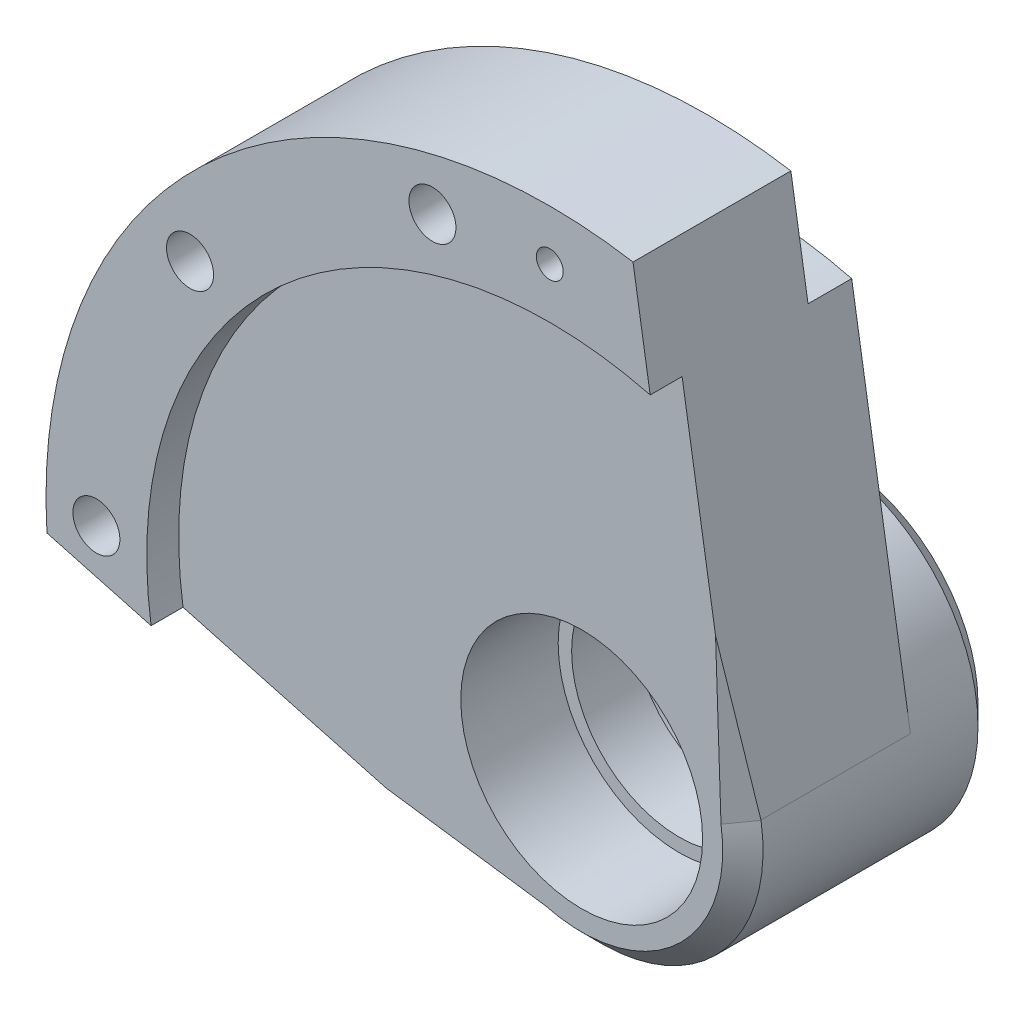
from build123d import *
from OCP.BRepAlgoAPI import BRepAlgoAPI_Cut
from OCP.TopTools import TopTools_ListOfShape
from build123d.topology import SkipClean

# Parameters (mm, degrees)
SCHIZZO1_R                          = 150
SCHIZZO1_R_2                        = 32
ESTRUSIONE1_DEPTH                   = 80.5
SCHIZZO2_R                          = 120
ESTRUSIONE2_DEPTH                   = 4.5
SCHIZZO3_R                          = 36
ESTRUSIONE3_DEPTH                   = 29
ESTRUSIONE4_START                   = -29
SCHIZZO4_R                          = 36
ESTRUSIONE4_DEPTH                   = 29
SCHIZZO5_OUTSIDE_W                  = 388.366
SCHIZZO5_OUTSIDE_H                  = 388.366
SCHIZZO5_OUTSIDE_R                  = 120
ESTRUSIONE5_DEPTH                   = 38.5
SCHIZZO6_OUTSIDE_W                  = 388.366
SCHIZZO6_OUTSIDE_H                  = 388.366
SCHIZZO6_OUTSIDE_R                  = 48
ESTRUSIONE6_DEPTH                   = 25.5
SCHIZZO7_R                          = 4
ESTRUSIONE7_DEPTH                   = 220.146070008
SCHIZZO8_R                          = 7
ESTRUSIONE8_DEPTH                   = 217.249855491
RIPETIZIONECIRCOLARE1_COUNT         = 3
RIPETIZIONECIRCOLARE1_ANGLE         = 75
SCHIZZO9_OUTSIDE_W                  = 388.366
SCHIZZO9_OUTSIDE_H                  = 388.366
ESTRUSIONE9_DEPTH                   = 220.146070008
SMUSSO1_SIZE                        = 6
TAGLIA_RIVOLUZIONE1_ANGLE           = 15
TAGLIA_RIVOLUZIONE1_OTHER_WAY_ANGLE = 99
ESTRUSIONE10_DEPTH                  = 222.553987295
ESTRUSIONE11_DEPTH                  = 222.120460483
SCHIZZO14_R                         = 7
SCHIZZO14_R_2                       = 4
ESTRUSIONE12_DEPTH                  = 5


with BuildPart() as part:
    # Schizzo1 → Estrusione1 (new body)
    with BuildSketch(Plane.XY):
        Circle(SCHIZZO1_R)
        Circle(SCHIZZO1_R_2, mode=Mode.SUBTRACT)
    extrude(amount=ESTRUSIONE1_DEPTH)

    # Schizzo2 → Estrusione2 (cut)
    with BuildSketch(Plane.XY.offset(80.5)):
        Circle(SCHIZZO2_R)
    extrude(amount=-ESTRUSIONE2_DEPTH, mode=Mode.SUBTRACT)

    # Schizzo3 → Estrusione3 (cut)
    with BuildSketch(Plane.XY.offset(76)):
        Circle(SCHIZZO3_R)
    extrude(amount=-ESTRUSIONE3_DEPTH, mode=Mode.SUBTRACT)

    # Schizzo4 → Estrusione4 (cut)
    with BuildSketch(Plane(origin=(0, 0, 0), x_dir=(-1, 0, 0), z_dir=(0, 0, -1)).offset(ESTRUSIONE4_START)):
        Circle(SCHIZZO4_R)
    extrude(amount=ESTRUSIONE4_DEPTH, mode=Mode.SUBTRACT)

    # Schizzo5 outside → Estrusione5 (cut)
    with BuildSketch(Plane(origin=(0, 0, 0), x_dir=(-1, 0, 0), z_dir=(0, 0, -1))):
        Rectangle(SCHIZZO5_OUTSIDE_W, SCHIZZO5_OUTSIDE_H)
        Circle(SCHIZZO5_OUTSIDE_R, mode=Mode.SUBTRACT)
    extrude(amount=-ESTRUSIONE5_DEPTH, mode=Mode.SUBTRACT)

    # Schizzo6 outside → Estrusione6 (cut)
    with BuildSketch(Plane(origin=(0, 0, 0), x_dir=(-1, 0, 0), z_dir=(0, 0, -1))):
        Rectangle(SCHIZZO6_OUTSIDE_W, SCHIZZO6_OUTSIDE_H)
        Circle(SCHIZZO6_OUTSIDE_R, mode=Mode.SUBTRACT)
    extrude(amount=-ESTRUSIONE6_DEPTH, mode=Mode.SUBTRACT)

    # Schizzo7 → Estrusione7 (cut, through all)
    with BuildSketch(Plane(origin=(0, 0, 25.5), x_dir=(-1, 0, 0), z_dir=(0, 0, -1))):
        with Locations((0, 135)):
            Circle(SCHIZZO7_R)
    extrude(amount=-ESTRUSIONE7_DEPTH, mode=Mode.SUBTRACT)

    # Schizzo8 → Estrusione8 (cut, through all)
    with BuildSketch(Plane(origin=(0, 0, 38.5), x_dir=(-1, 0, 0), z_dir=(0, 0, -1))):
        with Locations((135, 0)):
            Circle(SCHIZZO8_R)
    estrusione8 = extrude(amount=-ESTRUSIONE8_DEPTH, mode=Mode.SUBTRACT)

    # RipetizioneCircolare1: Estrusione8 ×3 about axis
    ripetizionecircolare1_axis = Axis((0, 0, 38.5), (0, 0, -1))
    for i in range(1, RIPETIZIONECIRCOLARE1_COUNT):
        add(estrusione8.rotate(ripetizionecircolare1_axis, i * RIPETIZIONECIRCOLARE1_ANGLE / (RIPETIZIONECIRCOLARE1_COUNT - 1)), mode=Mode.SUBTRACT)

    # Schizzo9 outside → Estrusione9 (cut, through all)
    with BuildSketch(Plane(origin=(0, 0, 25.5), x_dir=(-1, 0, 0), z_dir=(0, 0, -1))):
        Rectangle(SCHIZZO9_OUTSIDE_W, SCHIZZO9_OUTSIDE_H)
        with BuildLine():
            Line((-24.782961399, 147.938517041), (-47.388837837, 7.635368288))
            ThreePointArc((-47.388837837, 7.635368288), (-32.118274684, -35.670957819), (12.547023337, -46.331123511))
            Line((12.547023337, -46.331123511), (149.718619236, -9.183411899))
            ThreePointArc((149.718619236, -9.183411899), (100.369590954, 111.471723822), (-24.782961399, 147.938517041))
        make_face(mode=Mode.SUBTRACT)
    extrude(amount=-ESTRUSIONE9_DEPTH, mode=Mode.SUBTRACT)

    # Smusso1
    smusso1_edges = [part.edges().sort_by_distance(p)[0] for p in [
        (48, 0, 0),
    ]]
    chamfer(smusso1_edges, length=SMUSSO1_SIZE)


with BuildPart() as taglia_rivoluzione1_tool:
    # Schizzo10 → Taglia-Rivoluzione1 (revolve)
    with BuildSketch(Plane(origin=(0, 0, 0), x_dir=(0, 0, -1), z_dir=(1, 0, 0))):
        Polygon((-76, -42), (-70, -48), (-76, -48), align=None)
    revolve(axis=Axis((0, 0, 80.5), (0, 0, -1)), revolution_arc=TAGLIA_RIVOLUZIONE1_ANGLE)


with BuildPart() as part_1:
    add(part.part)

    # Taglia-Rivoluzione1: cut by taglia_rivoluzione1_tool, with a tolerance
    taglia_rivoluzione1_stock = TopTools_ListOfShape()
    taglia_rivoluzione1_stock.Append(part_1.part.wrapped)
    taglia_rivoluzione1_tools = TopTools_ListOfShape()
    taglia_rivoluzione1_tools.Append(taglia_rivoluzione1_tool.part.wrapped)
    taglia_rivoluzione1_cut = BRepAlgoAPI_Cut()
    taglia_rivoluzione1_cut.SetArguments(taglia_rivoluzione1_stock)
    taglia_rivoluzione1_cut.SetTools(taglia_rivoluzione1_tools)
    taglia_rivoluzione1_cut.SetFuzzyValue(0.00001)
    taglia_rivoluzione1_cut.Build()
    add(Compound.cast(taglia_rivoluzione1_cut.Shape()).solids(), mode=Mode.REPLACE)


with BuildPart() as taglia_rivoluzione1_other_way_tool:
    # Schizzo10 → Taglia-Rivoluzione1 other way (revolve)
    with BuildSketch(Plane(origin=(0, 0, 0), x_dir=(0, 0, -1), z_dir=(1, 0, 0))):
        Polygon((-76, -42), (-70, -48), (-76, -48), align=None)
    revolve(axis=Axis((0, 0, 80.5), (0, 0, 1)), revolution_arc=TAGLIA_RIVOLUZIONE1_OTHER_WAY_ANGLE)


with BuildPart() as part_2:
    add(part_1.part)

    # Taglia-Rivoluzione1 other way: cut by taglia_rivoluzione1_other_way_tool, with a tolerance
    taglia_rivoluzione1_other_way_stock = TopTools_ListOfShape()
    taglia_rivoluzione1_other_way_stock.Append(part_2.part.wrapped)
    taglia_rivoluzione1_other_way_tools = TopTools_ListOfShape()
    taglia_rivoluzione1_other_way_tools.Append(taglia_rivoluzione1_other_way_tool.part.wrapped)
    taglia_rivoluzione1_other_way_cut = BRepAlgoAPI_Cut()
    taglia_rivoluzione1_other_way_cut.SetArguments(taglia_rivoluzione1_other_way_stock)
    taglia_rivoluzione1_other_way_cut.SetTools(taglia_rivoluzione1_other_way_tools)
    taglia_rivoluzione1_other_way_cut.SetFuzzyValue(0.00001)
    taglia_rivoluzione1_other_way_cut.Build()
    add(Compound.cast(taglia_rivoluzione1_other_way_cut.Shape()).solids(), mode=Mode.REPLACE)

    # Schizzo12 → Estrusione10 (cut, through all)
    with BuildSketch(Plane(origin=(-0.690632867, 7.225398294, 0.448171286), x_dir=(-0.9954801399088248, -0.09476952983284632, -0.006166624876533003), z_dir=(-0.09496951603195239, 0.9935706966681883, 0.06162841671621708))):
        Polygon((-42.386736114, 75.435272849), (-48.338032454, 69.386961359), (-48.869626952, 76.181229843), align=None)
    extrude(amount=ESTRUSIONE10_DEPTH, mode=Mode.SUBTRACT)

    # Schizzo13 → Estrusione11 (cut, through all)
    with BuildSketch(Plane(origin=(-7.113626014, 1.442109288, 0.448171286), x_dir=(-0.06616982044642228, -0.016349891837027383, -0.9976744137738552), z_dir=(0.9782007948647303, -0.19830568115679875, -0.06162841671621941))):
        Polygon((-74.440666161, -44.110123665), (-68.257106923, -49.920768651), (-76.463406466, -52.458204579), align=None)
    extrude(amount=-ESTRUSIONE11_DEPTH, mode=Mode.SUBTRACT)

    # Schizzo14 → Estrusione12 (add)
    with SkipClean():  # the faces are left unmerged after this step: merging them gives an invalid solid
        with BuildSketch(Plane.XY.offset(80.5)):
            with BuildLine():
                Line((24.782961399, 147.938517041), (29.894014885, 116.216814076))
                ThreePointArc((29.894014885, 116.216814076), (-80.295672763, 89.177379057), (-118.704941646, -17.582287363))
                Line((-118.704941646, -17.582287363), (-149.718619236, -9.183411899))
                ThreePointArc((-149.718619236, -9.183411899), (-100.369590954, 111.471723822), (24.782961399, 147.938517041))
            make_face()
            with Locations((-135, 0)):
                Circle(SCHIZZO14_R, mode=Mode.SUBTRACT)
            with Locations((-107.102700939, 82.182792916)):
                Circle(SCHIZZO14_R, mode=Mode.SUBTRACT)
            with Locations((-34.940571089, 130.399986549)):
                Circle(SCHIZZO14_R, mode=Mode.SUBTRACT)
            with Locations((0, 135)):
                Circle(SCHIZZO14_R_2, mode=Mode.SUBTRACT)
        extrude(amount=ESTRUSIONE12_DEPTH)


solid = part_2.part
